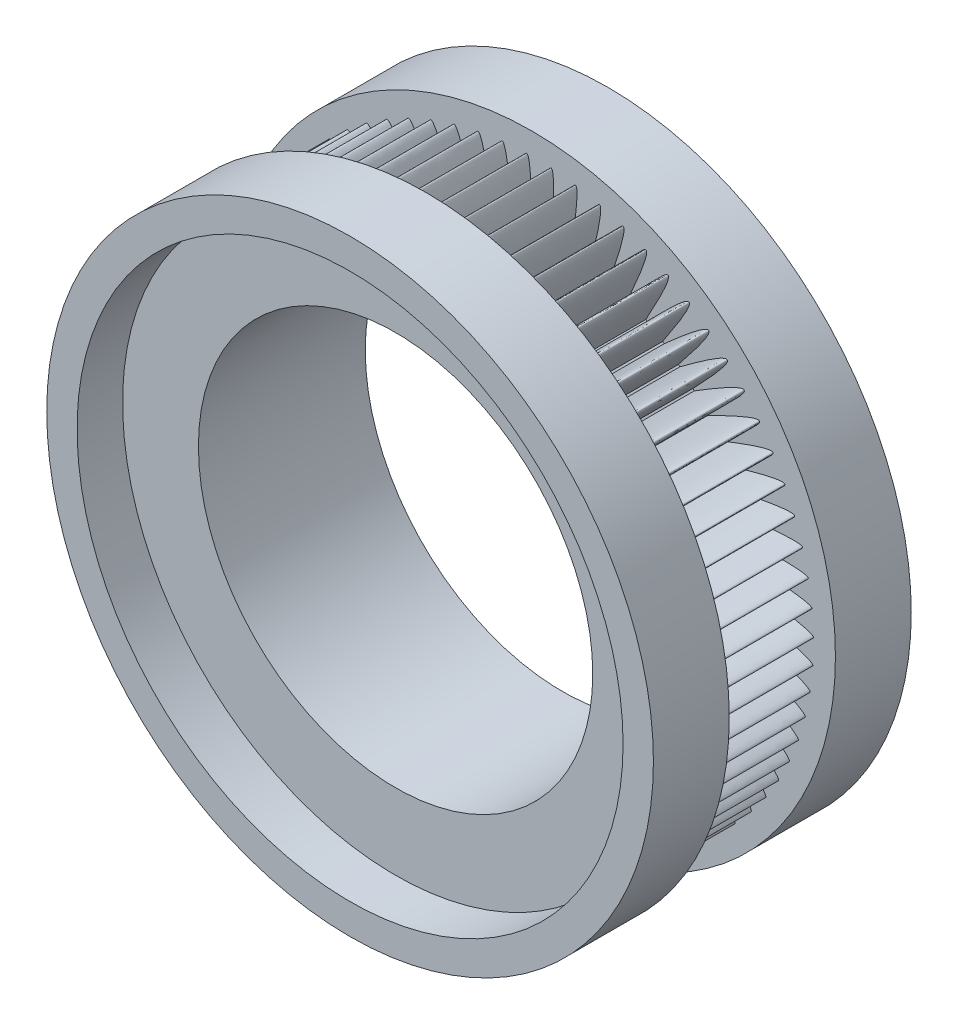
from build123d import *

# Parameters (mm, degrees)
SKETCH1_R            = 25.4
BOSS_EXTRUDE1_DEPTH  = 6.35
SKETCH2_R            = 19.05
BOSS_EXTRUDE2_DEPTH  = 8.89
SKETCH3_R            = 25.4
BOSS_EXTRUDE3_DEPTH  = 6.35
BOSS_EXTRUDE4_DEPTH  = 8.89
CIRPATTERN1_COUNT    = 72
SHELL2_OUTLINE_R     = 16.51
SHELL2_DEPTH         = 21.59
SHELL2_2_OUTLINE_R   = 22.86
SHELL2_2_OUTLINE_R_2 = 16.51
SHELL2_2_DEPTH       = 3.81
SHELL2_START         = 17.78
SHELL2_3_OUTLINE_R   = 22.86
SHELL2_3_OUTLINE_R_2 = 16.51
SHELL2_3_DEPTH       = 3.81


# Read off the part's stored shape, not the designer's step: Shell2
with BuildPart() as part:
    # Sketch1 → Boss-Extrude1 (new body)
    with BuildSketch(Plane.XY):
        Circle(SKETCH1_R)
    extrude(amount=BOSS_EXTRUDE1_DEPTH)

    # Sketch2 → Boss-Extrude2 (add)
    with BuildSketch(Plane.XY.offset(6.35)):
        Circle(SKETCH2_R)
    extrude(amount=BOSS_EXTRUDE2_DEPTH)

    # Sketch3 → Boss-Extrude3 (add)
    with BuildSketch(Plane.XY.offset(15.24)):
        Circle(SKETCH3_R)
    extrude(amount=BOSS_EXTRUDE3_DEPTH)

    # Sketch4 → Boss-Extrude4 (add)
    with BuildSketch(Plane.XY.offset(6.35)):
        with BuildLine():
            Line((-1.496949871, 18.991093731), (0, 19.05))
            add(Edge.make_bspline(
                [(0, 19.05), (-0.167462418, 28.102508347), (-1.496949871, 18.991093731)],
                knots=[0, 0, 0, 1, 1, 1], degree=2))
        make_face()
    boss_extrude4 = extrude(amount=BOSS_EXTRUDE4_DEPTH)

    # CirPattern1: Boss-Extrude4 ×72 about axis
    cirpattern1_axis = Axis((0, 0, 15.24), (0, 0, -1))
    for i in range(1, CIRPATTERN1_COUNT):
        add(boss_extrude4.rotate(cirpattern1_axis, i * 360 / CIRPATTERN1_COUNT))

    # Shell2 outline → Shell2 (cut)
    with BuildSketch(Plane.XY):
        Circle(SHELL2_OUTLINE_R)
    extrude(amount=SHELL2_DEPTH, mode=Mode.SUBTRACT)

    # Shell2 2 outline → Shell2 2 (cut)
    with BuildSketch(Plane.XY):
        Circle(SHELL2_2_OUTLINE_R)
        Circle(SHELL2_2_OUTLINE_R_2, mode=Mode.SUBTRACT)
    extrude(amount=SHELL2_2_DEPTH, mode=Mode.SUBTRACT)

    # Shell2 3 outline → Shell2 3 (cut)
    with BuildSketch(Plane.XY.offset(SHELL2_START)):
        Circle(SHELL2_3_OUTLINE_R)
        Circle(SHELL2_3_OUTLINE_R_2, mode=Mode.SUBTRACT)
    extrude(amount=SHELL2_3_DEPTH, mode=Mode.SUBTRACT)


solid = part.part
